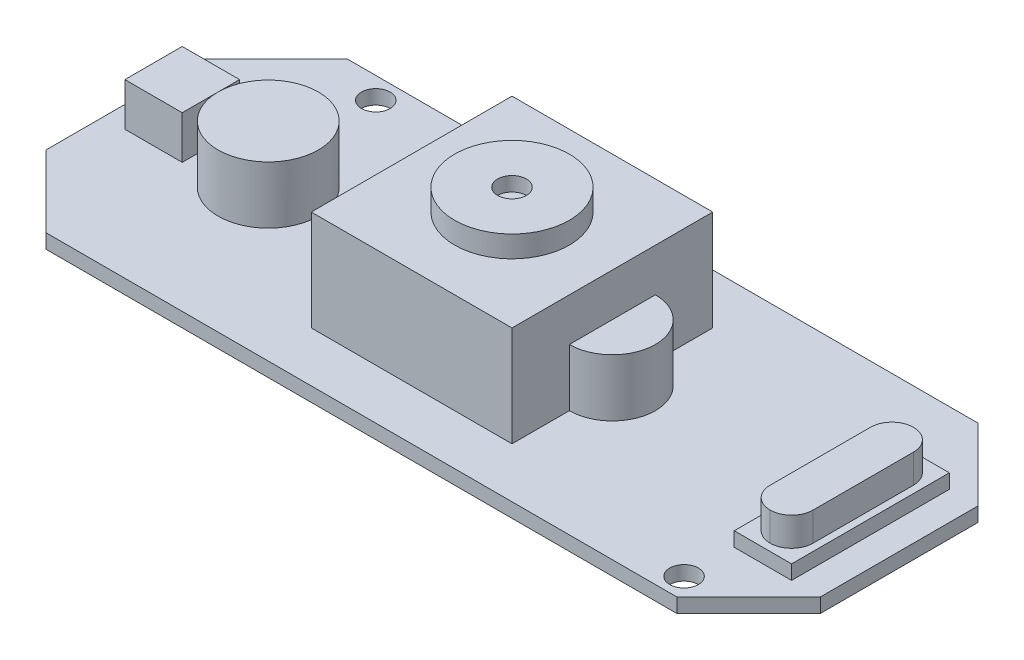
from build123d import *

# Parameters (mm, degrees)
BOSS_EXTRUDE1_DEPTH = 1
SKETCH2_W           = 14
SKETCH2_H           = 14
BOSS_EXTRUDE2_DEPTH = 7
SKETCH3_R           = 4
BOSS_EXTRUDE3_DEPTH = 1.5
BOSS_EXTRUDE4_DEPTH = 4
SKETCH6_R           = 1
CUT_EXTRUDE1_DEPTH  = 1
CUT_EXTRUDE2_REACH  = 32.191
SKETCH7_R           = 1
SKETCH8_R           = 3.5
BOSS_EXTRUDE5_DEPTH = 4
SKETCH9_W           = 4
SKETCH9_H           = 4
BOSS_EXTRUDE6_DEPTH = 3
SKETCH11_W          = 4
SKETCH11_H          = 11
BOSS_EXTRUDE7_DEPTH = 1
SKETCH12_W          = 3
SKETCH12_H          = 10
BOSS_EXTRUDE8_DEPTH = 2
FILLET1_R           = 1.5


with BuildPart() as part:
    # Sketch1 → Boss-Extrude1 (new body)
    with BuildSketch(Plane(origin=(0, 0, 0), x_dir=(1, 0, 0), z_dir=(0, 1, 0))):
        Polygon((-22, -10.5), (22, -10.5), (27, -5.5), (27, 5.5), (22, 10.5), (-22, 10.5), (-27, 5.5), (-27, -5.5), align=None)
    extrude(amount=BOSS_EXTRUDE1_DEPTH)

    # Sketch2 → Boss-Extrude2 (add)
    with BuildSketch(Plane(origin=(0, 1, 0), x_dir=(1, 0, 0), z_dir=(0, 1, 0))):
        Rectangle(SKETCH2_W, SKETCH2_H)
    extrude(amount=BOSS_EXTRUDE2_DEPTH)

    # Sketch3 → Boss-Extrude3 (add)
    with BuildSketch(Plane(origin=(0, 8, 0), x_dir=(1, 0, 0), z_dir=(0, 1, 0))):
        with Locations(Location((0, 0, 0), (0, 0, 270))):
            Circle(SKETCH3_R)
    extrude(amount=BOSS_EXTRUDE3_DEPTH)

    # Sketch4 → Boss-Extrude4 (add)
    with BuildSketch(Plane(origin=(0, 1, 0), x_dir=(1, 0, 0), z_dir=(0, 1, 0))):
        with BuildLine():
            ThreePointArc((7, -3), (9.121320344, -2.121320344), (10, 0))
            ThreePointArc((10, 0), (9.121320344, 2.121320344), (7, 3))
            Line((7, 3), (7, -3))
        make_face()
        with BuildLine():
            Line((7, -3), (7, 3))
            ThreePointArc((7, 3), (4, 0), (7, -3))
        make_face()
        with BuildLine():
            ThreePointArc((-7, -3), (-4.878679656, -2.121320344), (-4, 0))
            ThreePointArc((-4, 0), (-4.878679656, 2.121320344), (-7, 3))
            Line((-7, 3), (-7, -3))
        make_face()
        with BuildLine():
            Line((-7, -3), (-7, 3))
            ThreePointArc((-7, 3), (-10, 0), (-7, -3))
        make_face()
    extrude(amount=BOSS_EXTRUDE4_DEPTH)

    # Sketch6 → Cut-Extrude1 (cut)
    with BuildSketch(Plane(origin=(0, 9.5, 0), x_dir=(1, 0, 0), z_dir=(0, 1, 0))):
        with Locations(Location((0, 0, 0), (0, 0, 270))):
            Circle(SKETCH6_R)
    extrude(amount=-CUT_EXTRUDE1_DEPTH, mode=Mode.SUBTRACT)

    # Sketch7 → Cut-Extrude2 (cut, up to next)
    with BuildSketch(Plane(origin=(0, 1, 0), x_dir=(1, 0, 0), z_dir=(0, 1, 0)), mode=Mode.PRIVATE) as cut_extrude2_sk1:
        with Locations(Location((-18.5, 9, 0), (0, 0, 270))):
            Circle(SKETCH7_R)
    cut_extrude2_tool1 = extrude(cut_extrude2_sk1.sketch, amount=-CUT_EXTRUDE2_REACH, mode=Mode.PRIVATE) & part.part
    # Sketch7 → Cut-Extrude2 (cut, up to next)
    with BuildSketch(Plane(origin=(0, 1, 0), x_dir=(1, 0, 0), z_dir=(0, 1, 0)), mode=Mode.PRIVATE) as cut_extrude2_sk2:
        with Locations(Location((21, -9, 0), (0, 0, 270))):
            Circle(SKETCH7_R)
    cut_extrude2_tool2 = extrude(cut_extrude2_sk2.sketch, amount=-CUT_EXTRUDE2_REACH, mode=Mode.PRIVATE) & part.part
    add(cut_extrude2_tool1.solids().sort_by_distance((-18.5, 1, -9))[0], mode=Mode.SUBTRACT)
    add(cut_extrude2_tool2.solids().sort_by_distance((21, 1, 9))[0], mode=Mode.SUBTRACT)

    # Sketch8 → Boss-Extrude5 (add)
    with BuildSketch(Plane(origin=(0, 1, 0), x_dir=(1, 0, 0), z_dir=(0, 1, 0))):
        with Locations(Location((-17, 0, 0), (0, 0, 90))):
            Circle(SKETCH8_R)
    extrude(amount=BOSS_EXTRUDE5_DEPTH)

    # Sketch9 → Boss-Extrude6 (add)
    with BuildSketch(Plane(origin=(0, 1, 0), x_dir=(1, 0, 0), z_dir=(0, 1, 0))):
        with Locations((-23.5, 0.5)):
            Rectangle(SKETCH9_W, SKETCH9_H)
    extrude(amount=BOSS_EXTRUDE6_DEPTH)

    # Sketch11 → Boss-Extrude7 (add)
    with BuildSketch(Plane(origin=(0, 1, 0), x_dir=(1, 0, 0), z_dir=(0, 1, 0))):
        with Locations((23, 0)):
            Rectangle(SKETCH11_W, SKETCH11_H)
    extrude(amount=BOSS_EXTRUDE7_DEPTH)

    # Sketch12 → Boss-Extrude8 (add)
    with BuildSketch(Plane(origin=(0, 2, 0), x_dir=(1, 0, 0), z_dir=(0, 1, 0))):
        with Locations((23, 0)):
            Rectangle(SKETCH12_W, SKETCH12_H)
    extrude(amount=BOSS_EXTRUDE8_DEPTH)

    # Fillet1
    fillet1_edges = [part.edges().sort_by_distance(p)[0] for p in [
        (24.5, 3, -5),
        (21.5, 3, -5),
        (21.5, 3, 5),
        (24.5, 3, 5),
    ]]
    fillet(fillet1_edges, radius=FILLET1_R - 0.0001)  # a hair under: the kernel refuses the full size


solid = part.part
